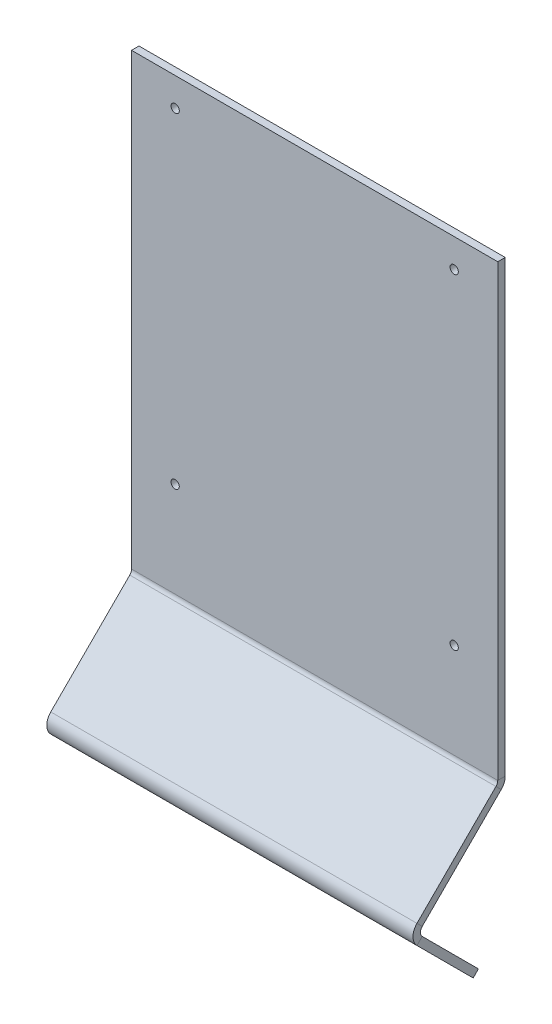
from build123d import *

# Parameters (mm, degrees)
SKETCH1_W               = 100
SKETCH1_H               = 180.7762
BASE_FLANGE1_DEPTH      = 2.032
SKETCHED_BEND1_DEPTH    = 100
SKETCHED_BEND1_2_DEPTH  = 100
SKETCHED_BEND2_DEPTH    = 100
SKETCHED_BEND2_2_DEPTH  = 100
CUT_EXTRUDE1_DEPTH      = 196.207207632
CUT_EXTRUDE1_DEPTH_BACK = 196.207207632
SKETCH1_4_R             = 1.13
F_4_40_TAPPED_HOLE1_D   = 2.2606
SKETCH11_R              = 2.5
CUT_EXTRUDE2_DEPTH      = 2.032
F_1_4_20_TAPPED_HOLE3_D = 5.1054


# Read off the part's stored shape, not the designer's step: Sketched Bend1, Sketched Bend2
# Sheet-metal steps are written as plain solids
with BuildPart() as part:
    # Sketch1 → Base-Flange1 (new body)
    with BuildSketch(Plane.XY):
        with Locations((50, -90.3881)):
            Rectangle(SKETCH1_W, SKETCH1_H)
    extrude(amount=-BASE_FLANGE1_DEPTH)

    # Sketched Bend1 outline → Sketched Bend1 (cut)
    with BuildSketch(Plane.YZ):
        with BuildLine():
            Line((-125.297528233, -0.945834787), (-126.24336302, 0))
            Line((-126.24336302, 0), (-180.7762, 0))
            Line((-180.7762, 0), (-180.7762, -2.032))
            Line((-180.7762, -2.032), (-122.675293446, -2.032))
            ThreePointArc((-122.675293446, -2.032), (-124.094436686, -1.749714858), (-125.297528233, -0.945834787))
        make_face()
    extrude(amount=SKETCHED_BEND1_DEPTH, mode=Mode.SUBTRACT)

    # Sketched Bend1 2 outline → Sketched Bend1 2 (add)
    with BuildSketch(Plane.YZ):
        with BuildLine():
            Line((-163.561829245, 40.192148183), (-164.998670225, 38.755307204))
            Line((-164.998670225, 38.755307204), (-126.24336302, 0))
            Line((-126.24336302, 0), (-122.675293446, 0))
            ThreePointArc((-122.675293446, 0), (-123.316823952, 0.127608352), (-123.860687254, 0.491006192))
            Line((-123.860687254, 0.491006192), (-163.561829245, 40.192148183))
        make_face()
    extrude(amount=SKETCHED_BEND1_2_DEPTH)

    # Sketched Bend2 outline → Sketched Bend2 (cut)
    with BuildSketch(Plane.YZ):
        with BuildLine():
            Line((-164.998670225, 38.755307204), (-149.212692342, 22.969329321))
            ThreePointArc((-149.212692342, 22.969329321), (-147.197284992, 23.051802202), (-145.43684371, 22.067162648))
            Line((-145.43684371, 22.067162648), (-163.561829245, 40.192148183))
            Line((-163.561829245, 40.192148183), (-164.998670225, 38.755307204))
        make_face()
    extrude(amount=SKETCHED_BEND2_DEPTH, mode=Mode.SUBTRACT)

    # Sketched Bend2 2 outline → Sketched Bend2 2 (add)
    with BuildSketch(Plane.YZ):
        with BuildLine():
            Line((-164.604651788, 5.270142185), (-149.244472305, 20.630321668))
            ThreePointArc((-149.244472305, 20.630321668), (-148.059078497, 21.12132786), (-146.873684689, 20.630321668))
            Line((-146.873684689, 20.630321668), (-149.212692342, 22.969329321))
            ThreePointArc((-149.212692342, 22.969329321), (-150.000143771, 22.604753197), (-150.681313284, 22.067162648))
            Line((-150.681313284, 22.067162648), (-166.041492767, 6.706983165))
            Line((-166.041492767, 6.706983165), (-164.604651788, 5.270142185))
        make_face()
    extrude(amount=SKETCHED_BEND2_2_DEPTH)

    # Sketch1<4> → Cut-Extrude1 (cut, two sides: drawn at the far end of the back side and taken through both)
    with BuildSketch(Plane.XY.offset(-CUT_EXTRUDE1_DEPTH_BACK)):
        with Locations((11.9, -7.7868)):
            Circle(SKETCH1_4_R)
        with Locations((88.1, -7.7868)):
            Circle(SKETCH1_4_R)
        with Locations((88.1, -96.6868)):
            Circle(SKETCH1_4_R)
        with Locations((11.9, -96.6868)):
            Circle(SKETCH1_4_R)
    extrude(amount=CUT_EXTRUDE1_DEPTH + CUT_EXTRUDE1_DEPTH_BACK, mode=Mode.SUBTRACT)

    # #4-40 Tapped Hole1 (through all)
    with Locations(Plane(origin=(88.1, -96.6868, 0), x_dir=(1, 0, 0), z_dir=(0, 0, 1))):
        with Locations((0, 0), (-76.2, 0), (-76.2, 88.9), (0, 88.9)):
            Hole(F_4_40_TAPPED_HOLE1_D / 2)

    # Sketch11 → Cut-Extrude2 (cut)
    with BuildSketch(Plane(origin=(0, -86.374237966, 86.374237966), x_dir=(-1, 0, 0), z_dir=(0, -0.7071067811865487, 0.7071067811865465))):
        with Locations(Location((-10, 99.966512217, 0), (0, 0, 90))):
            Circle(SKETCH11_R)
        with Locations(Location((-50, 99.966512217, 0), (0, 0, 90))):
            Circle(SKETCH11_R)
        with Locations(Location((-90, 99.966512217, 0), (0, 0, 90))):
            Circle(SKETCH11_R)
    extrude(amount=-CUT_EXTRUDE2_DEPTH, mode=Mode.SUBTRACT)

    # 1/4-20 Tapped Hole3 (through all)
    with Locations(Plane(origin=(0, -86.374237966, 86.374237966), x_dir=(-1, 0, 0), z_dir=(0, -0.7071067811865487, 0.7071067811865465))):
        with Locations((-90, 99.966512217), (-50, 99.966512217), (-10, 99.966512217)):
            Hole(F_1_4_20_TAPPED_HOLE3_D / 2)


solid = part.part
